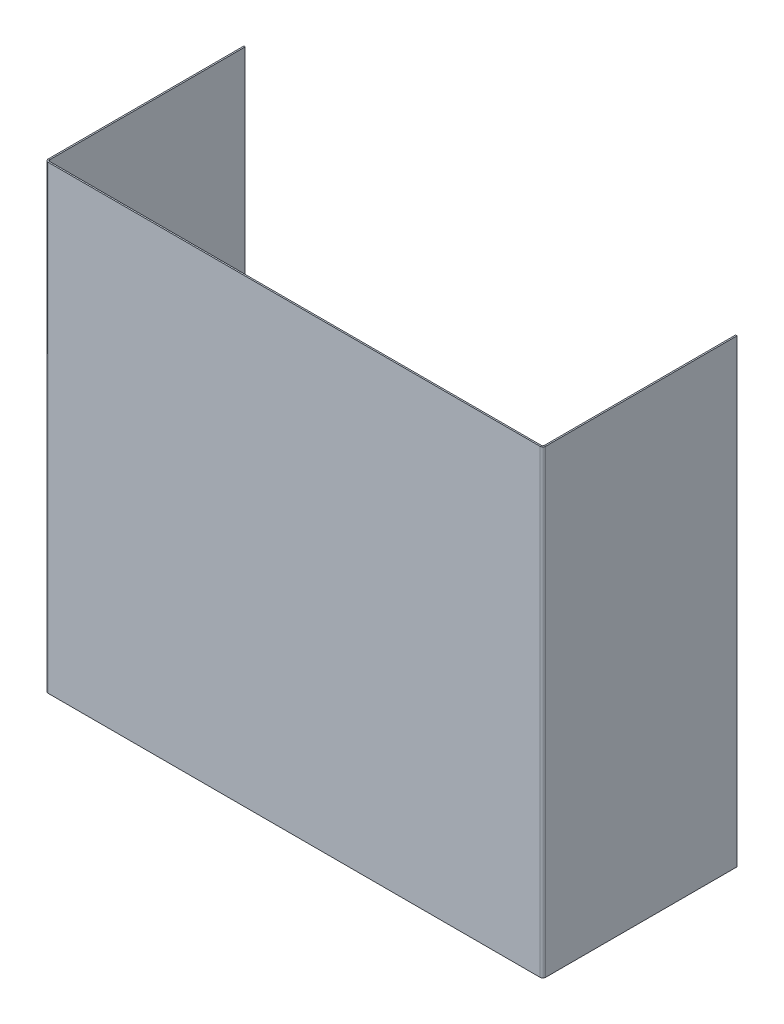
from build123d import *

# Parameters (mm, degrees)
BASE_FLANGE1_DEPTH = 238


# Sheet-metal steps are written as plain solids
with BuildPart() as part:
    # Sketch1 → Base-Flange1 (new body)
    with BuildSketch(Plane(origin=(0, 0, 0), x_dir=(1, 0, 0), z_dir=(0, 1, 0))):
        with BuildLine():
            Line((0, 0), (0, -101.2634))
            ThreePointArc((0, -101.2634), (0.215745145, -101.784254855), (0.7366, -102))
            Line((0.7366, -102), (255.2634, -102))
            ThreePointArc((255.2634, -102), (255.784254855, -101.784254855), (256, -101.2634))
            Line((256, -101.2634), (256, -2.25))
            Line((256, -2.25), (256.7366, -2.25))
            Line((256.7366, -2.25), (256.7366, -101.2634))
            ThreePointArc((256.7366, -101.2634), (256.30510971, -102.30510971), (255.2634, -102.7366))
            Line((255.2634, -102.7366), (0.7366, -102.7366))
            ThreePointArc((0.7366, -102.7366), (-0.30510971, -102.30510971), (-0.7366, -101.2634))
            Line((-0.7366, -101.2634), (-0.7366, 0))
            Line((-0.7366, 0), (0, 0))
        make_face()
    extrude(amount=BASE_FLANGE1_DEPTH)


solid = part.part
